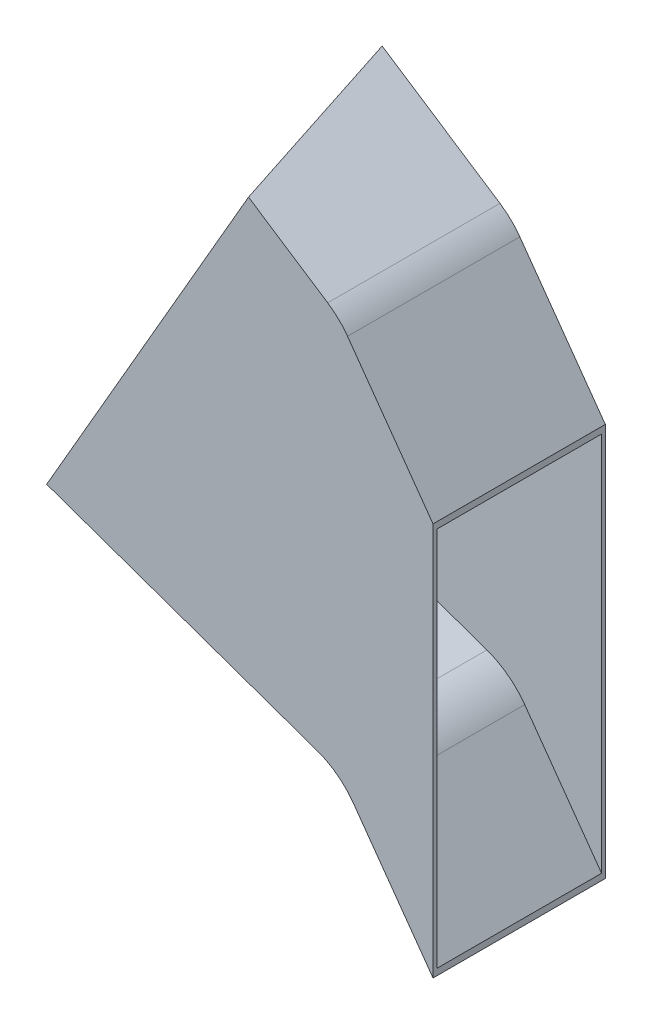
from build123d import *

# Parameters (mm, degrees)
BOSS_EXTRUDE1_DEPTH     = 116.84
FILLET1_R               = 50.8
SHELL2_T                = -2.54
CUT_EXTRUDE7_DEPTH      = 513.918688807
CUT_EXTRUDE7_DEPTH_BACK = 513.918688807


with BuildPart() as part:
    # Sketch1 → Boss-Extrude1 (new body)
    with BuildSketch(Plane.XY):
        Polygon((0, 0), (0, 266.7), (-63.5, 355.6), (-152.4, 413.968157867), (-279.4, 165.1), (-63.5, 88.9), align=None)
    extrude(amount=BOSS_EXTRUDE1_DEPTH)

    # Fillet1
    fillet1_edges = [part.edges().sort_by_distance(p)[0] for p in [
        (-63.5, 355.6, 58.42),
        (-63.5, 88.9, 58.42),
    ]]
    fillet(fillet1_edges, radius=FILLET1_R)

    # Shell2
    shell2_openings = [part.faces().sort_by_distance(p)[0] for p in [
        (-215.9, 289.534078933, 58.42),
        (0, 133.35, 58.42),
    ]]
    offset(amount=SHELL2_T, openings=shell2_openings, kind=Kind.INTERSECTION)

    # Sketch8 → Cut-Extrude7 (cut, two sides: drawn at the far end of the back side and taken through both)
    with BuildSketch(Plane(origin=(0, 0, 0), x_dir=(0, 0, -1), z_dir=(0.499999999999998, 0.8660254037844398, 0)).offset(-CUT_EXTRUDE7_DEPTH_BACK)):
        Polygon((0, 338.96635047), (0, 337.69635047), (-116.84, 306.389166826), (-116.84, 338.96635047), align=None)
    extrude(amount=CUT_EXTRUDE7_DEPTH + CUT_EXTRUDE7_DEPTH_BACK, mode=Mode.SUBTRACT)


solid = part.part
